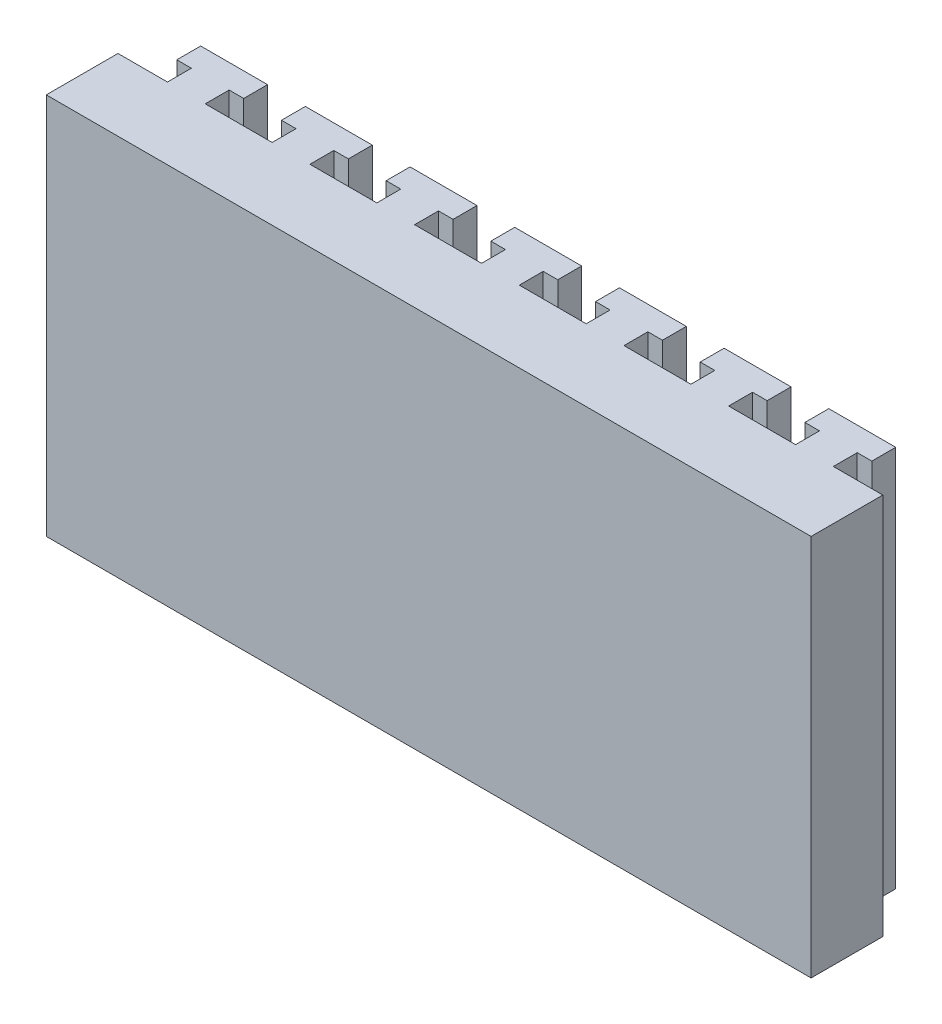
from build123d import *

# Parameters (mm, degrees)
SKETCH1_W           = 160
SKETCH1_H           = 80
BOSS_EXTRUDE1_DEPTH = 25
CUT_EXTRUDE1_START  = -80
CUT_EXTRUDE1_DEPTH  = 80


# Read off the part's stored shape, not the designer's step: Cut-Extrude1
with BuildPart() as part:
    # Sketch1 → Boss-Extrude1 (new body)
    with BuildSketch(Plane.XY):
        Rectangle(SKETCH1_W, SKETCH1_H)
    extrude(amount=BOSS_EXTRUDE1_DEPTH)

    # Cut-Extrude1 outline → Cut-Extrude1 (cut)
    with BuildSketch(Plane(origin=(0, 40, 0), x_dir=(1, 0, 0), z_dir=(0, 1, 0)).offset(CUT_EXTRUDE1_START)):
        Polygon((-80, 0), (-80, -10), (-69.65, -10), (-69.65, -5), (-72.7, -5), (-72.7, 0), align=None)
        Polygon((80, 0), (72.7, 0), (72.7, -5), (69.65, -5), (69.65, -10), (80, -10), align=None)
        Polygon((58.7, 0), (50.8, 0), (50.8, -5), (47.75, -5), (47.75, -10), (61.75, -10), (61.75, -5), (58.7, -5), align=None)
        Polygon((36.8, 0), (28.9, 0), (28.9, -5), (25.85, -5), (25.85, -10), (39.85, -10), (39.85, -5), (36.8, -5), align=None)
        Polygon((14.9, 0), (7, 0), (7, -5), (3.95, -5), (3.95, -10), (17.95, -10), (17.95, -5), (14.9, -5), align=None)
        Polygon((-7, 0), (-14.9, 0), (-14.9, -5), (-17.95, -5), (-17.95, -10), (-3.95, -10), (-3.95, -5), (-7, -5), align=None)
        Polygon((-28.9, 0), (-36.8, 0), (-36.8, -5), (-39.85, -5), (-39.85, -10), (-25.85, -10), (-25.85, -5), (-28.9, -5), align=None)
        Polygon((-50.8, 0), (-58.7, 0), (-58.7, -5), (-61.75, -5), (-61.75, -10), (-47.75, -10), (-47.75, -5), (-50.8, -5), align=None)
    extrude(amount=CUT_EXTRUDE1_DEPTH, mode=Mode.SUBTRACT)


solid = part.part
